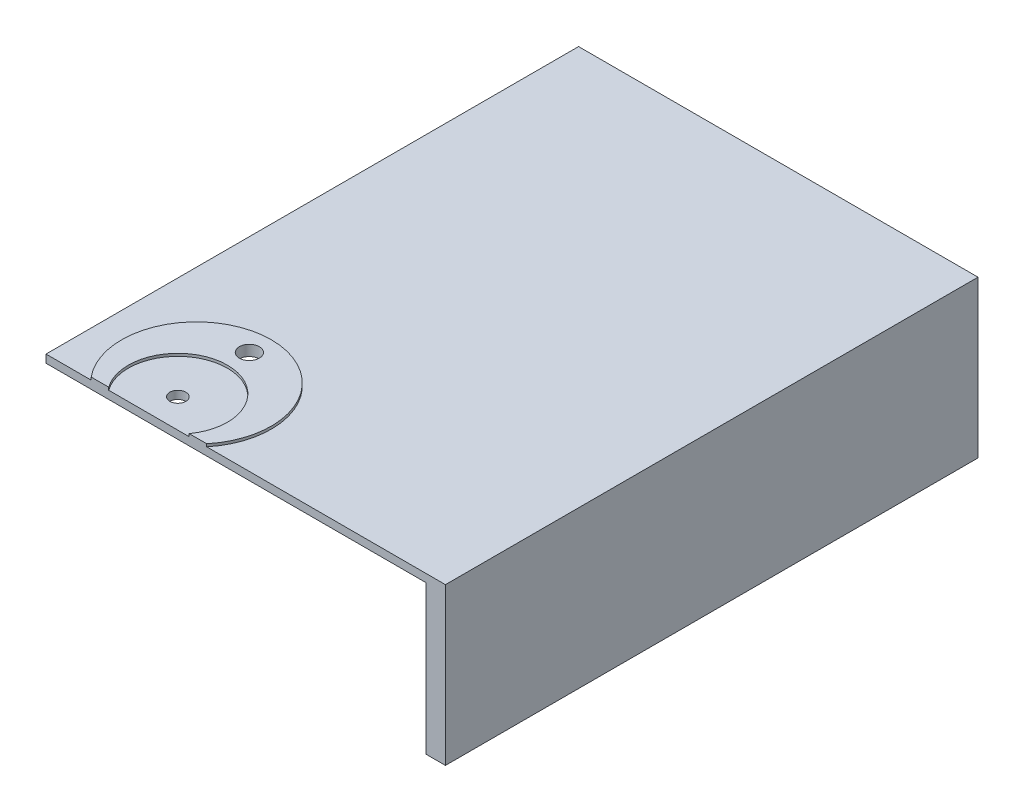
from build123d import *

# Parameters (mm, degrees)
SKETCH1_R           = 28.1
BOSS_EXTRUDE1_DEPTH = 1
SKETCH2_R           = 18.6
CUT_EXTRUDE1_DEPTH  = 58.8
SKETCH3_W           = 222.683092022
SKETCH3_H           = 364.2827524
BOSS_EXTRUDE2_DEPTH = 58.8
SKETCH4_W           = 207.917403516
SKETCH4_H           = 348.54429772
CUT_EXTRUDE2_DEPTH  = 55.8
SKETCH9_R           = 3
CUT_EXTRUDE8_DEPTH  = 10
SKETCH10_R          = 3.75
CUT_EXTRUDE9_DEPTH  = 10
CUT_EXTRUDE11_DEPTH = 500


with BuildPart() as part:
    # Sketch1 → Boss-Extrude1 (new body)
    with BuildSketch(Plane(origin=(0, 0, 0), x_dir=(1, 0, 0), z_dir=(0, 1, 0))):
        Circle(SKETCH1_R)
    extrude(amount=BOSS_EXTRUDE1_DEPTH)

    # Sketch2 → Cut-Extrude1 (cut)
    with BuildSketch(Plane(origin=(0, 1, 0), x_dir=(1, 0, 0), z_dir=(0, 1, 0))):
        with Locations((0, -7)):
            Circle(SKETCH2_R)
    extrude(amount=-CUT_EXTRUDE1_DEPTH, mode=Mode.SUBTRACT)

    # Sketch3 → Boss-Extrude2 (add)
    with BuildSketch(Plane(origin=(0, 0, 0), x_dir=(-1, 0, 0), z_dir=(0, -1, 0))):
        Rectangle(SKETCH3_W, SKETCH3_H)
    extrude(amount=BOSS_EXTRUDE2_DEPTH)

    # Sketch4 → Cut-Extrude2 (cut)
    with BuildSketch(Plane(origin=(0, -58.8, 0), x_dir=(-1, 0, 0), z_dir=(0, -1, 0))):
        Rectangle(SKETCH4_W, SKETCH4_H)
    extrude(amount=-CUT_EXTRUDE2_DEPTH, mode=Mode.SUBTRACT)

    # Sketch9 → Cut-Extrude8 (cut)
    with BuildSketch(Plane(origin=(0, 0, 0), x_dir=(1, 0, 0), z_dir=(0, 1, 0))):
        with Locations((0, -7)):
            Circle(SKETCH9_R)
    extrude(amount=-CUT_EXTRUDE8_DEPTH, mode=Mode.SUBTRACT)

    # Sketch10 → Cut-Extrude9 (cut)
    with BuildSketch(Plane(origin=(0, 1, 0), x_dir=(1, 0, 0), z_dir=(0, 1, 0))):
        with Locations((0, 19.85)):
            Circle(SKETCH10_R)
    extrude(amount=-CUT_EXTRUDE9_DEPTH, mode=Mode.SUBTRACT)

    # Sketch11 → Cut-Extrude11 (cut)
    with BuildSketch(Plane(origin=(0, -58.8, 0), x_dir=(-1, 0, 0), z_dir=(0, -1, 0))):
        Polygon((38.658453989, 182.1413762), (38.658453989, -17.8586238), (-111.341546011, -17.8586238), (-111.341546011, -182.1413762), (111.341546011, -182.1413762), (111.341546011, 182.1413762), align=None)
    extrude(amount=-CUT_EXTRUDE11_DEPTH, mode=Mode.SUBTRACT)


solid = part.part
